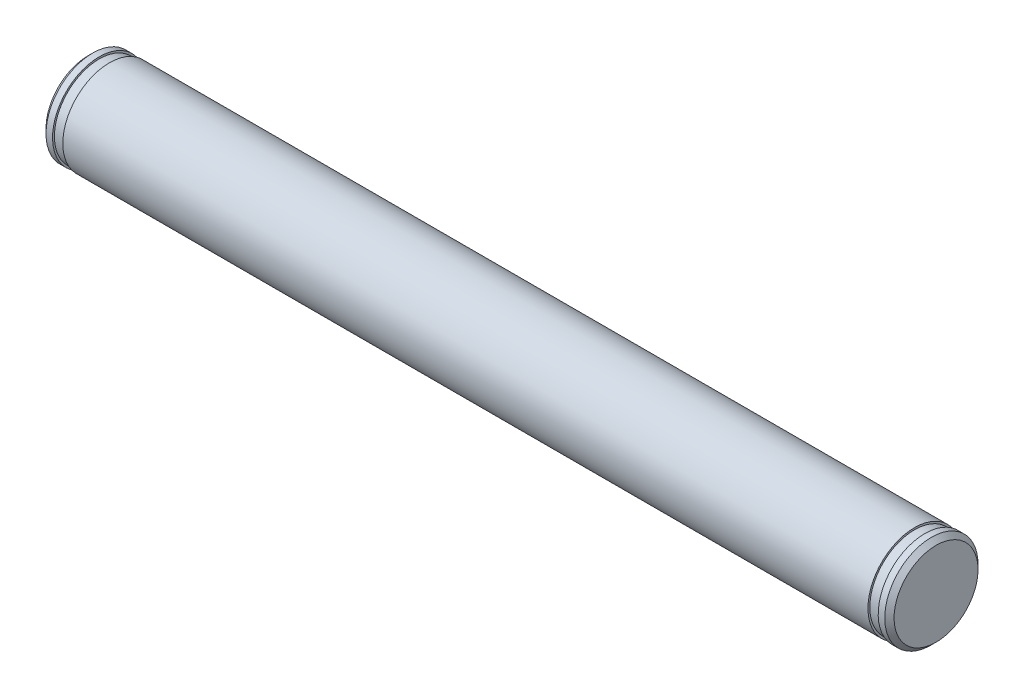
from build123d import *

# Parameters (mm, degrees)
CHAMFER_1_SIZE = 0.5


with BuildPart() as part:
    # 草图1 → 旋转1 (revolve)
    with BuildSketch(Plane.XY):
        Polygon((45.45, 0), (45.45, 5), (44.25, 5), (44.25, 4.8), (43.15, 4.8), (43.15, 5), (-43.15, 5), (-43.15, 4.8), (-44.25, 4.8), (-44.25, 5), (-45.45, 5), (-45.45, 0), align=None)
    revolve(axis=Axis((45.45, 0, 0), (-1, 0, 0)))

    # 倒角1
    chamfer_1_edges = [part.edges().sort_by_distance(p)[0] for p in [
        (45.45, -5, 0),
        (-45.45, -5, 0),
    ]]
    chamfer(chamfer_1_edges, length=CHAMFER_1_SIZE)


solid = part.part
